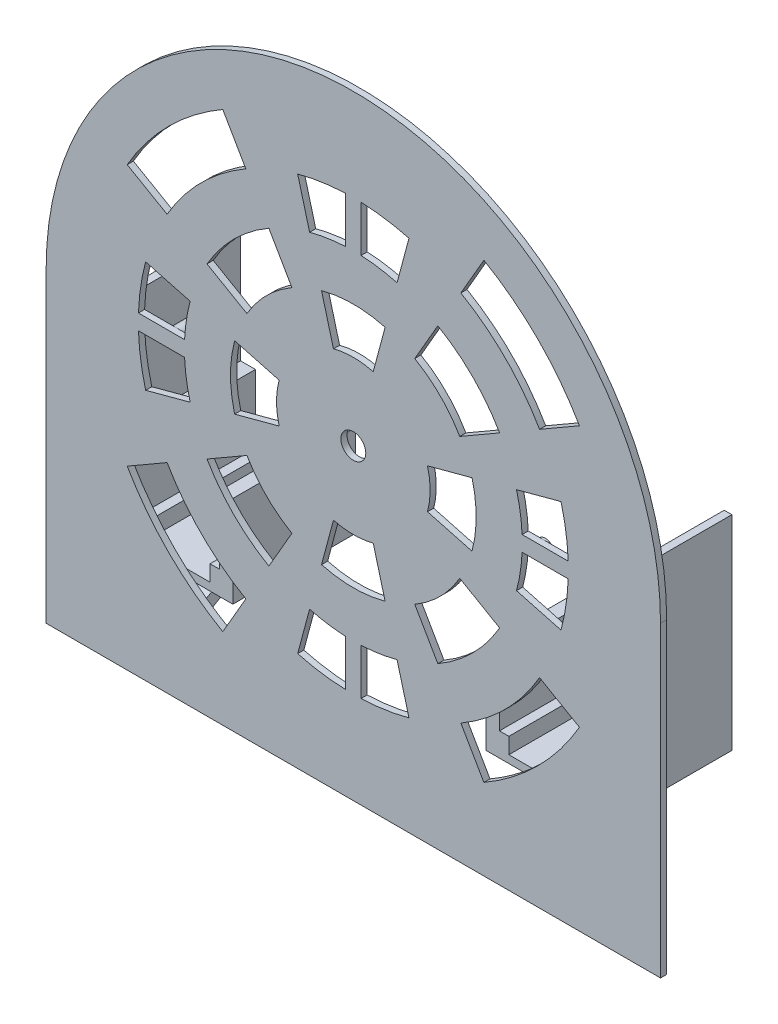
from build123d import *

# Parameters (mm, degrees)
SKETCH2_R           = 4.05
BOSS_EXTRUDE1_DEPTH = 2
BOSS_EXTRUDE2_DEPTH = 40
BOSS_EXTRUDE3_DEPTH = 5
BOSS_EXTRUDE4_DEPTH = 2
SKETCH10_R          = 2.5
BOSS_EXTRUDE5_DEPTH = 7
DOME1_FACE_RADIUS   = 2.5
DOME1_HEIGHT        = 1
SKETCH12_R          = 2.5
BOSS_EXTRUDE6_DEPTH = 0.75
DOME2_FACE_RADIUS   = 2.5
DOME2_HEIGHT        = 1


with BuildPart() as part:
    # Sketch2 → Boss-Extrude1 (new body)
    with BuildSketch(Plane.XY):
        with BuildLine():
            Line((-100, 0), (-100, -100))
            Line((-100, -100), (100, -100))
            Line((100, -100), (100, 0))
            ThreePointArc((100, 0), (0, 100), (-100, 0))
        make_face()
        Circle(SKETCH2_R, mode=Mode.SUBTRACT)
        with BuildLine():
            Line((6.470476128, 24.148145657), (10.352761804, 38.637033052))
            ThreePointArc((10.352761804, 38.637033052), (0, 40), (-10.352761804, 38.637033052))
            Line((-10.352761804, 38.637033052), (-6.470476128, 24.148145657))
            ThreePointArc((-6.470476128, 24.148145657), (0, 25), (6.470476128, 24.148145657))
        make_face(mode=Mode.SUBTRACT)
        with BuildLine():
            Line((14.235047481, 53.125920446), (18.117333157, 67.61480784))
            ThreePointArc((18.117333157, 67.61480784), (0, 70), (-18.117333157, 67.61480784))
            Line((-18.117333157, 67.61480784), (-14.235047481, 53.125920446))
            ThreePointArc((-14.235047481, 53.125920446), (0, 55), (14.235047481, 53.125920446))
        make_face(mode=Mode.SUBTRACT)
        with BuildLine():
            Line((-20, 34.641016151), (-27.5, 47.631397208))
            ThreePointArc((-27.5, 47.631397208), (-38.890872965, 38.890872965), (-47.631397208, 27.5))
            Line((-47.631397208, 27.5), (-34.641016151, 20))
            ThreePointArc((-34.641016151, 20), (-28.284271247, 28.284271247), (-20, 34.641016151))
        make_face(mode=Mode.SUBTRACT)
        with BuildLine():
            Line((-35, 60.621778265), (-42.5, 73.612159322))
            ThreePointArc((-42.5, 73.612159322), (-60.104076401, 60.104076401), (-73.612159322, 42.5))
            Line((-73.612159322, 42.5), (-60.621778265, 35))
            ThreePointArc((-60.621778265, 35), (-49.497474683, 49.497474683), (-35, 60.621778265))
        make_face(mode=Mode.SUBTRACT)
        with BuildLine():
            Line((42.5, 73.612159322), (35, 60.621778265))
            ThreePointArc((35, 60.621778265), (49.497474683, 49.497474683), (60.621778265, 35))
            Line((60.621778265, 35), (73.612159322, 42.5))
            ThreePointArc((73.612159322, 42.5), (60.104076401, 60.104076401), (42.5, 73.612159322))
        make_face(mode=Mode.SUBTRACT)
        with BuildLine():
            Line((27.5, 47.631397208), (20, 34.641016151))
            ThreePointArc((20, 34.641016151), (28.284271247, 28.284271247), (34.641016151, 20))
            Line((34.641016151, 20), (47.631397208, 27.5))
            ThreePointArc((47.631397208, 27.5), (38.890872965, 38.890872965), (27.5, 47.631397208))
        make_face(mode=Mode.SUBTRACT)
        with BuildLine():
            Line((24.148145657, -6.470476128), (38.637033052, -10.352761804))
            ThreePointArc((38.637033052, -10.352761804), (40, 0), (38.637033052, 10.352761804))
            Line((38.637033052, 10.352761804), (24.148145657, 6.470476128))
            ThreePointArc((24.148145657, 6.470476128), (25, 0), (24.148145657, -6.470476128))
        make_face(mode=Mode.SUBTRACT)
        with BuildLine():
            Line((53.125920446, -14.235047481), (67.61480784, -18.117333157))
            ThreePointArc((67.61480784, -18.117333157), (70, 0), (67.61480784, 18.117333157))
            Line((67.61480784, 18.117333157), (53.125920446, 14.235047481))
            ThreePointArc((53.125920446, 14.235047481), (55, 0), (53.125920446, -14.235047481))
        make_face(mode=Mode.SUBTRACT)
        with BuildLine():
            Line((73.612159322, -42.5), (60.621778265, -35))
            ThreePointArc((60.621778265, -35), (49.497474683, -49.497474683), (35, -60.621778265))
            Line((35, -60.621778265), (42.5, -73.612159322))
            ThreePointArc((42.5, -73.612159322), (60.104076401, -60.104076401), (73.612159322, -42.5))
        make_face(mode=Mode.SUBTRACT)
        with BuildLine():
            Line((47.631397208, -27.5), (34.641016151, -20))
            ThreePointArc((34.641016151, -20), (28.284271247, -28.284271247), (20, -34.641016151))
            Line((20, -34.641016151), (27.5, -47.631397208))
            ThreePointArc((27.5, -47.631397208), (38.890872965, -38.890872965), (47.631397208, -27.5))
        make_face(mode=Mode.SUBTRACT)
        with BuildLine():
            Line((-6.470476128, -24.148145657), (-10.352761804, -38.637033052))
            ThreePointArc((-10.352761804, -38.637033052), (0, -40), (10.352761804, -38.637033052))
            Line((10.352761804, -38.637033052), (6.470476128, -24.148145657))
            ThreePointArc((6.470476128, -24.148145657), (0, -25), (-6.470476128, -24.148145657))
        make_face(mode=Mode.SUBTRACT)
        with BuildLine():
            Line((-14.235047481, -53.125920446), (-18.117333157, -67.61480784))
            ThreePointArc((-18.117333157, -67.61480784), (0, -70), (18.117333157, -67.61480784))
            Line((18.117333157, -67.61480784), (14.235047481, -53.125920446))
            ThreePointArc((14.235047481, -53.125920446), (0, -55), (-14.235047481, -53.125920446))
        make_face(mode=Mode.SUBTRACT)
        with BuildLine():
            Line((-42.5, -73.612159322), (-35, -60.621778265))
            ThreePointArc((-35, -60.621778265), (-49.497474683, -49.497474683), (-60.621778265, -35))
            Line((-60.621778265, -35), (-73.612159322, -42.5))
            ThreePointArc((-73.612159322, -42.5), (-60.104076401, -60.104076401), (-42.5, -73.612159322))
        make_face(mode=Mode.SUBTRACT)
        with BuildLine():
            Line((-27.5, -47.631397208), (-20, -34.641016151))
            ThreePointArc((-20, -34.641016151), (-28.284271247, -28.284271247), (-34.641016151, -20))
            Line((-34.641016151, -20), (-47.631397208, -27.5))
            ThreePointArc((-47.631397208, -27.5), (-38.890872965, -38.890872965), (-27.5, -47.631397208))
        make_face(mode=Mode.SUBTRACT)
        with BuildLine():
            Line((-24.148145657, 6.470476128), (-38.637033052, 10.352761804))
            ThreePointArc((-38.637033052, 10.352761804), (-40, 0), (-38.637033052, -10.352761804))
            Line((-38.637033052, -10.352761804), (-24.148145657, -6.470476128))
            ThreePointArc((-24.148145657, -6.470476128), (-25, 0), (-24.148145657, 6.470476128))
        make_face(mode=Mode.SUBTRACT)
        with BuildLine():
            Line((-53.125920446, 14.235047481), (-67.61480784, 18.117333157))
            ThreePointArc((-67.61480784, 18.117333157), (-70, 0), (-67.61480784, -18.117333157))
            Line((-67.61480784, -18.117333157), (-53.125920446, -14.235047481))
            ThreePointArc((-53.125920446, -14.235047481), (-55, 0), (-53.125920446, 14.235047481))
        make_face(mode=Mode.SUBTRACT)
    extrude(amount=BOSS_EXTRUDE1_DEPTH)

    # Sketch4 → Boss-Extrude2 (add)
    with BuildSketch(Plane(origin=(0, 0, 0), x_dir=(-1, 0, 0), z_dir=(0, 0, -1))):
        Polygon((-70.814, -63.74), (-48.634, -63.74), (-48.634, -58.54), (-45.574, -58.54), (-45.574, -36.410509339), (-41.222261094, -36.410509339), (-41.222261094, -63.74), (-41.222261094, -66.24), (-76.222261094, -66.24), (-81.222261094, -66.24), (-81.222261094, 0.239543082), (-78.722261094, 0.239543082), (-78.722261094, -36.363042073), (-73.874, -36.363042073), (-73.874, -58.54), (-70.814, -58.54), align=None)
        Polygon((81.222261094, -66.24), (76.222261094, -66.24), (41.222261094, -66.24), (41.222261094, -63.74), (41.222261094, -36.410509339), (45.574, -36.410509339), (45.574, -58.54), (48.634, -58.54), (48.634, -63.74), (70.814, -63.74), (70.814, -58.54), (73.874, -58.54), (73.874, -36.363042073), (78.722261094, -36.363042073), (78.722261094, 0.239543082), (81.222261094, 0.239543082), align=None)
    extrude(amount=BOSS_EXTRUDE2_DEPTH)

    # Sketch7 → Boss-Extrude3 (add, symmetric)
    with BuildSketch(Plane(origin=(63, 0, 0), x_dir=(0, 0, -1), z_dir=(1, 0, 0))):
        Polygon((0, -86.447259422), (35, -66.24), (26.86565258, -66.24), (0, -81.750891749), align=None)
    boss_extrude3 = extrude(amount=BOSS_EXTRUDE3_DEPTH, both=True)

    # Mirror1: Boss-Extrude3 across plane
    add(boss_extrude3.mirror(Plane(origin=(0, 0, 0), x_dir=(0, 0, 1), z_dir=(1, 0, 0))))


with BuildPart() as boss_extrude4_tool:
    # Sketch8 → Boss-Extrude4 (new body)
    with BuildSketch(Plane.XY.offset(2)):
        with BuildLine():
            Line((-54.94315244, 2.5), (-69.955342898, 2.5))
            add(Edge.make_bspline(
                [(-69.955342898, 2.5), (-70.044657102, 0), (-69.955342898, -2.5)],
                knots=[0, 0, 0, 1, 1, 1], degree=2))
            Line((-69.955342898, -2.5), (-54.94315244, -2.5))
            add(Edge.make_bspline(
                [(-54.94315244, 2.5), (-55.05684756, 0), (-54.94315244, -2.5)],
                knots=[0, 0, 0, 1, 1, 1], degree=2))
        make_face()
        with BuildLine():
            Line((-2.5, 54.94315244), (-2.5, 69.955342898))
            add(Edge.make_bspline(
                [(2.5, 69.955342898), (0, 70.044657102), (-2.5, 69.955342898)],
                knots=[0, 0, 0, 1, 1, 1], degree=2))
            Line((2.5, 69.955342898), (2.5, 54.94315244))
            add(Edge.make_bspline(
                [(2.5, 54.94315244), (0, 55.05684756), (-2.5, 54.94315244)],
                knots=[0, 0, 0, 1, 1, 1], degree=2))
        make_face()
        with BuildLine():
            Line((54.94315244, 2.5), (69.955342898, 2.5))
            add(Edge.make_bspline(
                [(69.955342898, -2.5), (70.044657102, 0), (69.955342898, 2.5)],
                knots=[0, 0, 0, 1, 1, 1], degree=2))
            Line((69.955342898, -2.5), (54.94315244, -2.5))
            add(Edge.make_bspline(
                [(54.94315244, -2.5), (55.05684756, 0), (54.94315244, 2.5)],
                knots=[0, 0, 0, 1, 1, 1], degree=2))
        make_face()
        with BuildLine():
            Line((2.5, -54.94315244), (2.5, -69.955342898))
            add(Edge.make_bspline(
                [(-2.5, -69.955342898), (0, -70.044657102), (2.5, -69.955342898)],
                knots=[0, 0, 0, 1, 1, 1], degree=2))
            Line((-2.5, -69.955342898), (-2.5, -54.94315244))
            add(Edge.make_bspline(
                [(-2.5, -54.94315244), (0, -55.05684756), (2.5, -54.94315244)],
                knots=[0, 0, 0, 1, 1, 1], degree=2))
        make_face()
    extrude(amount=-BOSS_EXTRUDE4_DEPTH)


with BuildPart() as part_1:
    add(part.part)


with BuildPart() as part_2:
    # Boss-Extrude4: joined with boss_extrude4_tool
    add(part_1.part.fuse(boss_extrude4_tool.part, tol=0.00001))

    # Sketch10 → Boss-Extrude5 (add)
    with BuildSketch(Plane.XY.offset(2)):
        with Locations((-59.724, 0)):
            Circle(SKETCH10_R)
    extrude(amount=-BOSS_EXTRUDE5_DEPTH)

    # Dome1: a dome of height H over a round flat face of radius A is a cap of a sphere of radius (A * A + H * H) / (2 * H)
    dome1_r = (DOME1_FACE_RADIUS * DOME1_FACE_RADIUS + DOME1_HEIGHT * DOME1_HEIGHT) / (2 * DOME1_HEIGHT)
    dome1_base = Plane((-59.724, 0, -5), z_dir=(0, 0, -1))
    with Locations(dome1_base.offset(DOME1_HEIGHT - dome1_r)):
        dome1_ball = Sphere(dome1_r, mode=Mode.PRIVATE)
    add(split(dome1_ball, bisect_by=dome1_base, keep=Keep.TOP, mode=Mode.PRIVATE))

    # Sketch12 → Boss-Extrude6 (add)
    with BuildSketch(Plane(origin=(0, 0, 0), x_dir=(-1, 0, 0), z_dir=(0, 0, -1))):
        with Locations(Location((-59.724, 0, 0), (0, 0, 270))):
            Circle(SKETCH12_R)
    extrude(amount=BOSS_EXTRUDE6_DEPTH)

    # Dome2: a dome of height H over a round flat face of radius A is a cap of a sphere of radius (A * A + H * H) / (2 * H)
    dome2_r = (DOME2_FACE_RADIUS * DOME2_FACE_RADIUS + DOME2_HEIGHT * DOME2_HEIGHT) / (2 * DOME2_HEIGHT)
    dome2_base = Plane((59.724, 0, -0.75), z_dir=(0, 0, -1))
    with Locations(dome2_base.offset(DOME2_HEIGHT - dome2_r)):
        dome2_ball = Sphere(dome2_r, mode=Mode.PRIVATE)
    add(split(dome2_ball, bisect_by=dome2_base, keep=Keep.TOP, mode=Mode.PRIVATE))


solid = part_2.part
